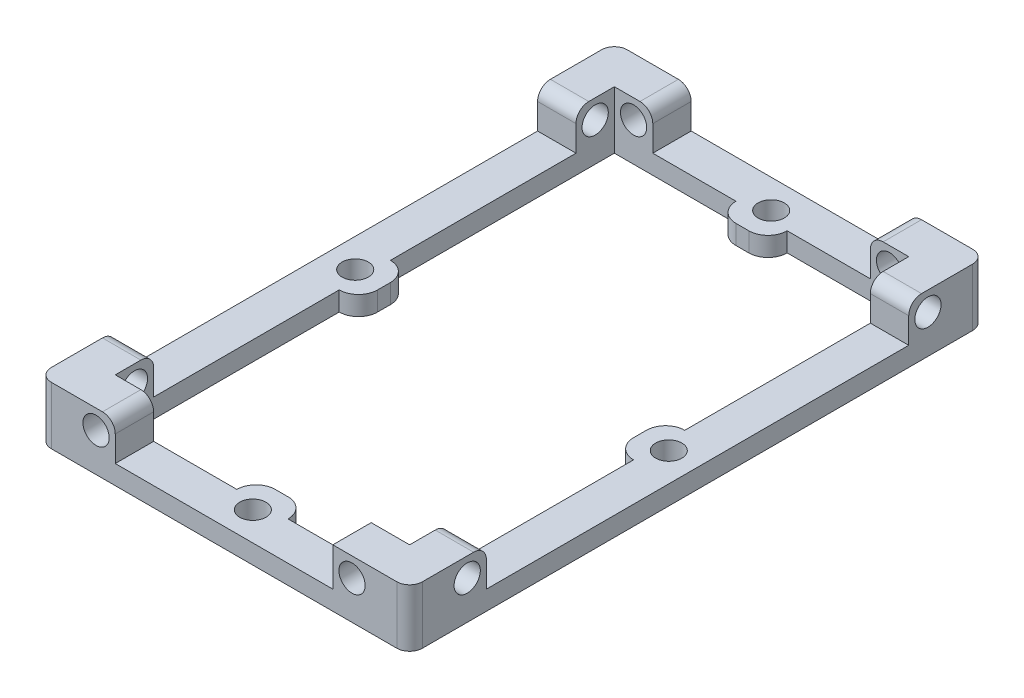
from build123d import *

# Parameters (mm, degrees)
SKETCH1_W           = 58
SKETCH1_H           = 90
SKETCH1_W_2         = 46
SKETCH1_H_2         = 78
BOSS_EXTRUDE1_DEPTH = 3
BOSS_EXTRUDE2_DEPTH = 6
SKETCH3_R           = 2.05
CUT_EXTRUDE1_DEPTH  = 108.447661678
SKETCH4_R           = 2.05
CUT_EXTRUDE2_DEPTH  = 108.447661678
FILLET1_R           = 2
FILLET2_R           = 2
SKETCH5_W           = 8
SKETCH5_H           = 3
BOSS_EXTRUDE3_DEPTH = 3
SKETCH6_R           = 2.05
CUT_EXTRUDE3_DEPTH  = 3
FILLET3_R           = 3
SKETCH7_W           = 3
SKETCH7_H           = 8
BOSS_EXTRUDE4_DEPTH = 3
SKETCH8_R           = 2.05
CUT_EXTRUDE4_DEPTH  = 108.238052948
FILLET4_R           = 3


with BuildPart() as part:
    # Sketch1 → Boss-Extrude1 (new body)
    with BuildSketch(Plane(origin=(0, 0, 0), x_dir=(1, 0, 0), z_dir=(0, 1, 0))):
        with Locations((29, -45)):
            Rectangle(SKETCH1_W, SKETCH1_H)
        with Locations((29, -45)):
            Rectangle(SKETCH1_W_2, SKETCH1_H_2, mode=Mode.SUBTRACT)
    extrude(amount=BOSS_EXTRUDE1_DEPTH)

    # Sketch2 → Boss-Extrude2 (add)
    with BuildSketch(Plane(origin=(0, 3, 0), x_dir=(1, 0, 0), z_dir=(0, 1, 0))):
        Polygon((46, -84), (46, -90), (58, -90), (58, -78), (52, -78), (52, -84), align=None)
        Polygon((52, -12), (58, -12), (58, 0), (46, 0), (46, -6), (52, -6), align=None)
        Polygon((0, 0), (0, -12), (6, -12), (6, -6), (12, -6), (12, 0), align=None)
        Polygon((0, -90), (12, -90), (12, -84), (6, -84), (6, -78), (0, -78), align=None)
    extrude(amount=BOSS_EXTRUDE2_DEPTH)

    # Sketch3 → Cut-Extrude1 (cut, through all)
    with BuildSketch(Plane.ZY):
        with Locations((9, 6)):
            Circle(SKETCH3_R)
        with Locations((81, 6)):
            Circle(SKETCH3_R)
    extrude(amount=-CUT_EXTRUDE1_DEPTH, mode=Mode.SUBTRACT)

    # Sketch4 → Cut-Extrude2 (cut, through all)
    with BuildSketch(Plane(origin=(0, 0, 0), x_dir=(-1, 0, 0), z_dir=(0, 0, -1))):
        with Locations((-49, 6)):
            Circle(SKETCH4_R)
        with Locations((-9, 6)):
            Circle(SKETCH4_R)
    extrude(amount=-CUT_EXTRUDE2_DEPTH, mode=Mode.SUBTRACT)

    # Fillet1
    fillet1_edges = [part.edges().sort_by_distance(p)[0] for p in [
        (55, 9, 78),
        (55, 9, 12),
        (46, 9, 3),
        (3, 9, 12),
        (12, 9, 3),
        (3, 9, 78),
        (12, 9, 87),
    ]]
    fillet(fillet1_edges, radius=FILLET1_R)

    # Fillet2
    fillet2_edges = [part.edges().sort_by_distance(p)[0] for p in [
        (0, 4.5, 0),
        (58, 4.5, 0),
        (58, 4.5, 90),
        (0, 4.5, 90),
    ]]
    fillet(fillet2_edges, radius=FILLET2_R)

    # Sketch5 → Boss-Extrude3 (add)
    with BuildSketch(Plane.XZ):
        with Locations((29, 7.5)):
            Rectangle(SKETCH5_W, SKETCH5_H)
        with Locations((29, 82.5)):
            Rectangle(SKETCH5_W, SKETCH5_H)
    extrude(amount=-BOSS_EXTRUDE3_DEPTH)

    # Sketch6 → Cut-Extrude3 (cut)
    with BuildSketch(Plane.XZ):
        with Locations(Location((29, 85.5, 0), (0, 0, 270))):
            Circle(SKETCH6_R)
        with Locations(Location((29, 4.5, 0), (0, 0, 270))):
            Circle(SKETCH6_R)
    extrude(amount=-CUT_EXTRUDE3_DEPTH, mode=Mode.SUBTRACT)

    # Fillet3
    fillet3_edges = [part.edges().sort_by_distance(p)[0] for p in [
        (33, 1.5, 81),
        (25, 1.5, 81),
        (33, 1.5, 9),
        (25, 1.5, 9),
    ]]
    fillet(fillet3_edges, radius=FILLET3_R - 0.0001)  # a hair under: the kernel refuses the full size

    # Sketch7 → Boss-Extrude4 (add)
    with BuildSketch(Plane.XZ):
        with Locations((50.5, 45)):
            Rectangle(SKETCH7_W, SKETCH7_H)
        with Locations((7.5, 45)):
            Rectangle(SKETCH7_W, SKETCH7_H)
    extrude(amount=-BOSS_EXTRUDE4_DEPTH)

    # Sketch8 → Cut-Extrude4 (cut, through all)
    with BuildSketch(Plane(origin=(0, 3, 0), x_dir=(1, 0, 0), z_dir=(0, 1, 0))):
        with Locations(Location((4.5, -45, 0), (0, 0, 270))):
            Circle(SKETCH8_R)
        with Locations(Location((53.5, -45, 0), (0, 0, 270))):
            Circle(SKETCH8_R)
    extrude(amount=-CUT_EXTRUDE4_DEPTH, mode=Mode.SUBTRACT)

    # Fillet4
    fillet4_edges = [part.edges().sort_by_distance(p)[0] for p in [
        (49, 1.5, 41),
        (49, 1.5, 49),
        (9, 1.5, 41),
        (9, 1.5, 49),
    ]]
    fillet(fillet4_edges, radius=FILLET4_R - 0.0001)  # a hair under: the kernel refuses the full size


solid = part.part
